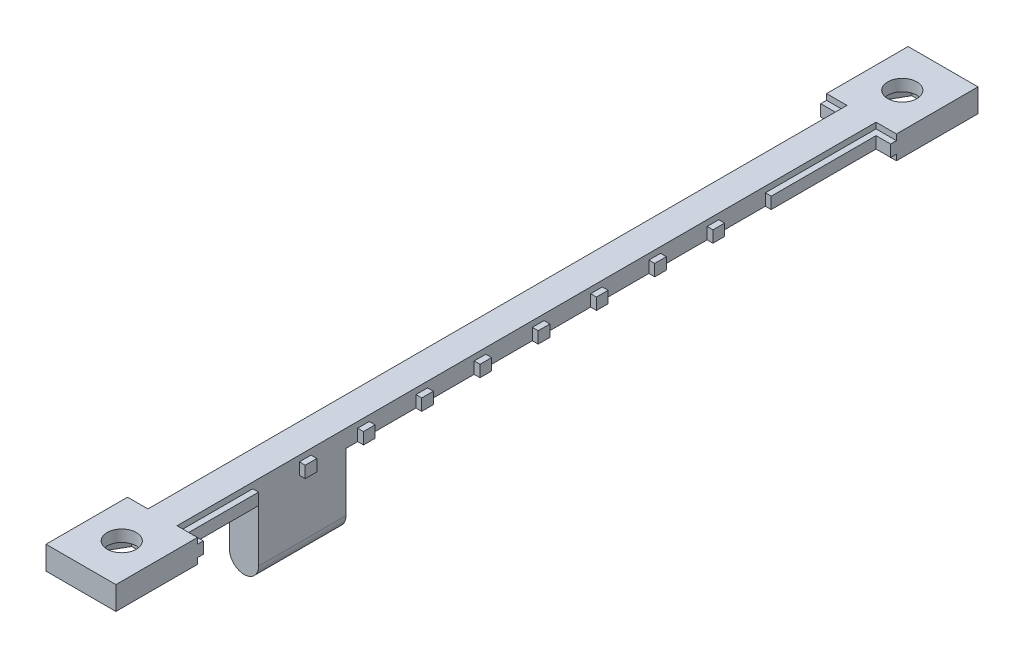
from build123d import *

# Parameters (mm, degrees)
BOSS_EXTRUDE1_DEPTH  = 2
BOSS_EXTRUDE2_DEPTH  = 1
SKETCH3_W            = 12
SKETCH3_H            = 12
BOSS_EXTRUDE3_DEPTH  = 1
CUT_EXTRUDE1_DEPTH   = 2
SKETCH5_R            = 2.5
CUT_EXTRUDE2_DEPTH   = 5
SKETCH6_W            = 3
SKETCH6_H            = 15
BOSS_EXTRUDE4_DEPTH  = 5
CUT_EXTRUDE3_DEPTH   = 30
SKETCH9_W            = 3
SKETCH9_H            = 7
CUT_EXTRUDE5_DEPTH   = 20
SKETCH10_W           = 5
SKETCH10_H           = 15
BOSS_EXTRUDE5_DEPTH  = 3
CUT_EXTRUDE7_DEPTH   = 20
SKETCH12_W           = 5
SKETCH12_H           = 15
BOSS_EXTRUDE7_DEPTH  = 12.5
CUT_EXTRUDE9_DEPTH   = 40
SKETCH14_W           = 1
SKETCH14_H           = 2
CUT_EXTRUDE11_DEPTH  = 20
SKETCH15_W           = 12
SKETCH15_H           = 1
BOSS_EXTRUDE13_DEPTH = 4
BOSS_EXTRUDE14_DEPTH = 2


with BuildPart() as part:
    # Sketch1 → Boss-Extrude1 (new body)
    with BuildSketch(Plane(origin=(0, 0, 0), x_dir=(1, 0, 0), z_dir=(0, 1, 0))):
        Polygon((7.22672382, 6.096), (7.22672382, 18.096), (6.22672382, 18.096), (6.22672382, 20.096), (7.22672382, 20.096), (7.22672382, 28.096), (6.22672382, 28.096), (6.22672382, 30.096), (7.22672382, 30.096), (7.22672382, 38.096), (6.22672382, 38.096), (6.22672382, 40.096), (7.22672382, 40.096), (7.22672382, 48.096), (6.22672382, 48.096), (6.22672382, 50.096), (7.22672382, 50.096), (7.22672382, 58.096), (6.22672382, 58.096), (6.22672382, 60.096), (7.22672382, 60.096), (7.22672382, 68.096), (6.22672382, 68.096), (6.22672382, 70.096), (7.22672382, 70.096), (7.22672382, 78.096), (6.22672382, 78.096), (6.22672382, 80.096), (7.22672382, 80.096), (7.22672382, 88.096), (6.22672382, 88.096), (6.22672382, 90.096), (7.22672382, 90.096), (7.22672382, 98.096), (6.22672382, 98.096), (6.22672382, 100.096), (7.22672382, 100.096), (7.22672382, 108.096), (6.22672382, 108.096), (6.22672382, 110.096), (7.22672382, 110.096), (7.22672382, 118.096), (6.22672382, 118.096), (6.22672382, 120.096), (7.22672382, 120.096), (7.22672382, 128.096), (3.72672382, 128.096), (3.72672382, 140.096), (15.72672382, 140.096), (15.72672382, 128.096), (12.22672382, 128.096), (12.22672382, 120.096), (13.22672382, 120.096), (13.22672382, 118.096), (12.22672382, 118.096), (12.22672382, 110.096), (13.226723821, 110.096), (13.226723821, 108.096), (12.22672382, 108.096), (12.22672382, 100.096), (13.226723821, 100.096), (13.226723821, 98.096), (12.22672382, 98.096), (12.22672382, 90.096), (13.226723821, 90.096), (13.226723821, 88.096), (12.22672382, 88.096), (12.22672382, 80.096), (13.226723821, 80.096), (13.226723821, 78.096), (12.22672382, 78.096), (12.22672382, 70.096), (13.226723821, 70.096), (13.226723821, 68.096), (12.22672382, 68.096), (12.22672382, 60.096), (13.226723821, 60.096), (13.226723821, 58.096), (12.22672382, 58.096), (12.22672382, 50.096), (13.226723821, 50.096), (13.226723821, 48.096), (12.22672382, 48.096), (12.22672382, 40.096), (13.226723821, 40.096), (13.226723821, 38.096), (12.22672382, 38.096), (12.22672382, 30.096), (13.226723821, 30.096), (13.226723821, 28.096), (12.22672382, 28.096), (12.22672382, 20.096), (13.226723821, 20.096), (13.226723821, 18.096), (12.22672382, 18.096), (12.22672382, 6.096), (15.72672382, 6.096), (15.72672382, -5.904), (3.72672382, -5.904), (3.72672382, 6.096), align=None)
    extrude(amount=BOSS_EXTRUDE1_DEPTH)

    # Sketch2 → Boss-Extrude2 (add)
    with BuildSketch(Plane(origin=(0, 2, 0), x_dir=(1, 0, 0), z_dir=(0, 1, 0))):
        Polygon((3.72672382, 140.096), (15.72672382, 140.096), (15.72672382, 128.096), (12.22672382, 128.096), (12.22672382, 6.096), (15.72672382, 6.096), (15.72672382, -5.904), (3.72672382, -5.904), (3.72672382, 6.096), (7.22672382, 6.096), (7.22672382, 128.096), (3.72672382, 128.096), align=None)
    extrude(amount=BOSS_EXTRUDE2_DEPTH)

    # Sketch3 → Boss-Extrude3 (add)
    with BuildSketch(Plane(origin=(0, 0, 0), x_dir=(-1, 0, 0), z_dir=(0, -1, 0))):
        with Locations((-9.72672382, 134.096)):
            Rectangle(SKETCH3_W, SKETCH3_H)
        with Locations((-9.72672382, 0.096)):
            Rectangle(SKETCH3_W, SKETCH3_H)
    extrude(amount=BOSS_EXTRUDE3_DEPTH)

    # Sketch4 → Cut-Extrude1 (cut)
    with BuildSketch(Plane(origin=(0, -1, 0), x_dir=(-1, 0, 0), z_dir=(0, -1, 0))):
        Polygon((-7.365059478, 138.096), (-11.983861632, 138.096), (-14.293262708, 134.096), (-11.983861632, 130.096), (-7.365059478, 130.096), (-5.055658401, 134.096), align=None)
        Polygon((-7.417322744, 4.096), (-12.036124897, 4.096), (-14.345525974, 0.096), (-12.036124897, -3.904), (-7.417322744, -3.904), (-5.107921667, 0.096), align=None)
    extrude(amount=-CUT_EXTRUDE1_DEPTH, mode=Mode.SUBTRACT)

    # Sketch5 → Cut-Extrude2 (cut)
    with BuildSketch(Plane(origin=(0, 1, 0), x_dir=(-1, 0, 0), z_dir=(0, -1, 0))):
        with Locations((-9.72672382, 0.096)):
            Circle(SKETCH5_R)
        with Locations((-9.72672382, 134.096)):
            Circle(SKETCH5_R)
    extrude(amount=-CUT_EXTRUDE2_DEPTH, mode=Mode.SUBTRACT)

    # Sketch6 → Boss-Extrude4 (add)
    with BuildSketch(Plane(origin=(0, 0, 0), x_dir=(-1, 0, 0), z_dir=(0, -1, 0))):
        with Locations((-9.72672382, 28.596)):
            Rectangle(SKETCH6_W, SKETCH6_H)
    extrude(amount=BOSS_EXTRUDE4_DEPTH)

    # Sketch7 → Cut-Extrude3 (cut)
    with BuildSketch(Plane(origin=(0, 0, -36.096), x_dir=(-1, 0, 0), z_dir=(0, 0, -1))):
        with BuildLine():
            Line((-9.72672381, -5), (-8.22672382, -5))
            Line((-8.22672382, -5), (-8.22672382, -1))
            add(Edge.make_bspline(
                [(-9.72672382, -5), (-8.22672382, -5), (-8.22672382, -1)],
                knots=[6.283185307, 6.283185307, 6.283185307, 7.853981634, 7.853981634, 7.853981634], degree=2, weights=[1, 0.707106781, 1]))
        make_face()
        with BuildLine():
            Line((-11.22672382, -5), (-9.72672381, -5))
            add(Edge.make_bspline(
                [(-11.22672382, -1), (-11.22672382, -5), (-9.72672382, -5)],
                knots=[4.71238898, 4.71238898, 4.71238898, 6.283185307, 6.283185307, 6.283185307], degree=2, weights=[1, 0.707106781, 1]))
            Line((-11.22672382, -1), (-11.22672382, -5))
        make_face()
    extrude(amount=-CUT_EXTRUDE3_DEPTH, mode=Mode.SUBTRACT)

    # Sketch9 → Cut-Extrude5 (cut)
    with BuildSketch(Plane.XY.offset(-21.096)):
        with Locations((9.72672382, -3.5)):
            Rectangle(SKETCH9_W, SKETCH9_H)
    extrude(amount=-CUT_EXTRUDE5_DEPTH, mode=Mode.SUBTRACT)

    # Sketch10 → Boss-Extrude5 (add)
    with BuildSketch(Plane(origin=(0, 0, 0), x_dir=(-1, 0, 0), z_dir=(0, -1, 0))):
        with Locations((-9.72672382, 28.596)):
            Rectangle(SKETCH10_W, SKETCH10_H)
    extrude(amount=BOSS_EXTRUDE5_DEPTH)

    # Sketch11 → Cut-Extrude7 (cut)
    with BuildSketch(Plane(origin=(0, 0, -36.096), x_dir=(-1, 0, 0), z_dir=(0, 0, -1))):
        with BuildLine():
            Line((-7.22672382, -3), (-7.22672382, 0))
            ThreePointArc((-7.22672382, 0), (-9.72672382, -2.5), (-12.22672382, 0))
            Line((-12.22672382, 0), (-12.22672382, -3))
            Line((-12.22672382, -3), (-7.22672382, -3))
        make_face()
    extrude(amount=-CUT_EXTRUDE7_DEPTH, mode=Mode.SUBTRACT)

    # Sketch12 → Boss-Extrude7 (add)
    with BuildSketch(Plane(origin=(0, 0, 0), x_dir=(-1, 0, 0), z_dir=(0, -1, 0))):
        with Locations((-9.72672382, 28.596)):
            Rectangle(SKETCH12_W, SKETCH12_H)
    extrude(amount=BOSS_EXTRUDE7_DEPTH)

    # Sketch13 → Cut-Extrude9 (cut)
    with BuildSketch(Plane(origin=(0, 0, -36.096), x_dir=(-1, 0, 0), z_dir=(0, 0, -1))):
        with BuildLine():
            Line((-7.22672382, -12.5), (-7.22672382, -10))
            ThreePointArc((-7.22672382, -10), (-7.958956868, -11.767766953), (-9.72672382, -12.5))
            Line((-9.72672382, -12.5), (-7.22672382, -12.5))
        make_face()
        with BuildLine():
            ThreePointArc((-9.72672382, -12.5), (-11.494490773, -11.767766953), (-12.22672382, -10))
            Line((-12.22672382, -10), (-12.22672382, -12.5))
            Line((-12.22672382, -12.5), (-9.72672382, -12.5))
        make_face()
    extrude(amount=-CUT_EXTRUDE9_DEPTH, mode=Mode.SUBTRACT)

    # Sketch14 → Cut-Extrude11 (cut)
    with BuildSketch(Plane(origin=(0, 0, 0), x_dir=(-1, 0, 0), z_dir=(0, -1, 0))):
        with Locations((-12.72672382, 119.096)):
            Rectangle(SKETCH14_W, SKETCH14_H)
    extrude(amount=-CUT_EXTRUDE11_DEPTH, mode=Mode.SUBTRACT)

    # Sketch15 → Boss-Extrude13 (add)
    with BuildSketch(Plane(origin=(0, -1, 0), x_dir=(-1, 0, 0), z_dir=(0, -1, 0))):
        with Locations((-9.72672382, 140.596)):
            Rectangle(SKETCH15_W, SKETCH15_H)
        with Locations((-9.72672382, 127.596)):
            Rectangle(SKETCH15_W, SKETCH15_H)
        with Locations((-9.72672382, 6.596)):
            Rectangle(SKETCH15_W, SKETCH15_H)
        with Locations((-9.72672382, -6.404)):
            Rectangle(SKETCH15_W, SKETCH15_H)
    extrude(amount=-BOSS_EXTRUDE13_DEPTH)

    # Sketch16 → Boss-Extrude14 (add)
    with BuildSketch(Plane(origin=(0, 0, 0), x_dir=(-1, 0, 0), z_dir=(0, -1, 0))):
        Polygon((-15.72672382, 7.096), (-12.22672382, 7.096), (-12.22672382, 8.096), (-12.22672382, 18.096), (-13.226723821, 18.096), (-13.226723821, 8.096), (-15.72672382, 8.096), align=None)
        Polygon((-6.22672382, 110.096), (-7.22672382, 110.096), (-7.22672382, 127.096), (-3.72672382, 127.096), (-3.72672382, 126.096), (-6.22672382, 126.096), align=None)
        Polygon((-15.72672382, 127.096), (-12.22672382, 127.096), (-12.22672382, 110.096), (-13.226723821, 110.096), (-13.226723821, 126.096), (-15.72672382, 126.096), align=None)
        Polygon((-3.72672382, 7.096), (-3.72672382, 8.096), (-6.22672382, 8.096), (-6.22672382, 18.096), (-7.22672382, 18.096), (-7.22672382, 8.096), (-7.22672382, 7.096), align=None)
    extrude(amount=-BOSS_EXTRUDE14_DEPTH)


solid = part.part
